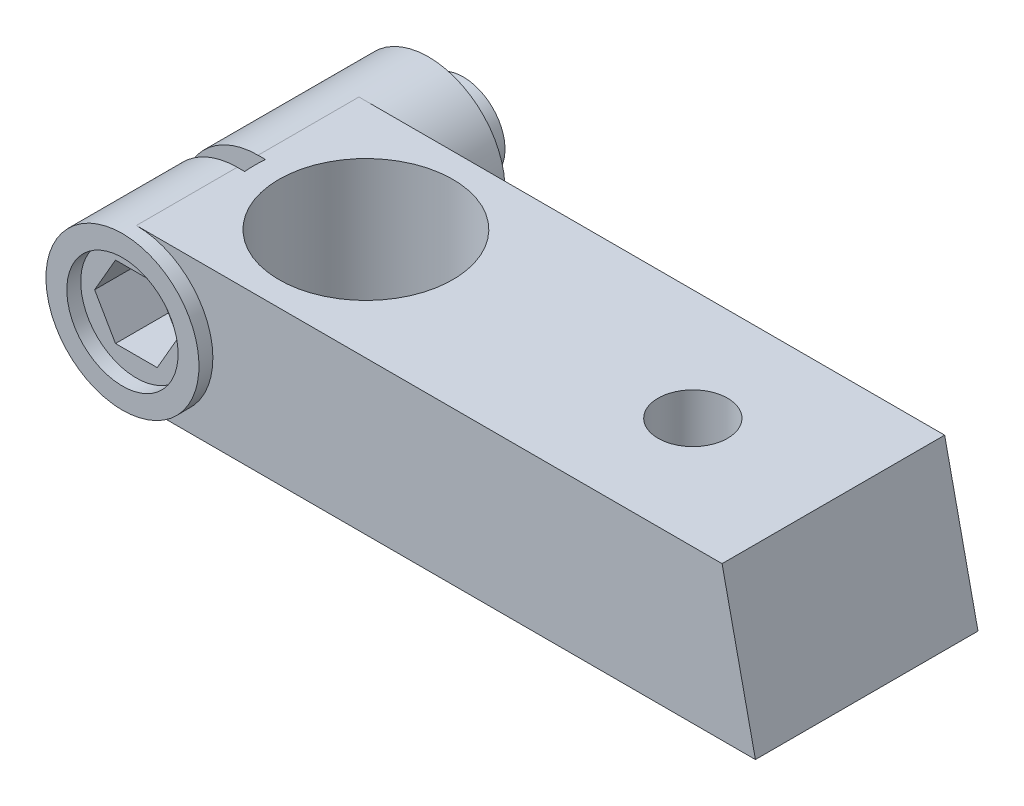
from build123d import *

# Parameters (mm, degrees)
BOSS_EXTRUDE1_DEPTH            = 20
SKETCH2_R                      = 12.5
CUT_EXTRUDE1_DEPTH             = 20
CUT_EXTRUDE3_DEPTH             = 16
BOSS_EXTRUDE9_DEPTH            = 32
CUT_EXTRUDE5_OUTLINE_R         = 12.5
CUT_EXTRUDE5_DEPTH             = 20
SKETCH10_R                     = 7.5
BOSS_EXTRUDE10_DEPTH           = 6
SKETCH11_R                     = 6.5
BOSS_EXTRUDE11_DEPTH           = 5
FILLET5_R                      = 1
FILLET6_R                      = 1
CUT_EXTRUDE7_DEPTH             = 147.965990964
CUT_EXTRUDE7_DEPTH_BACK        = 147.965990964
CUT_EXTRUDE8_REACH             = 148.864
SKETCH21_R                     = 5
CUT_EXTRUDE8_DIRECTION_2_DEPTH = 147.863882558
SKETCH23_R                     = 12.5
SKETCH23_R_2                   = 5
BOSS_EXTRUDE12_DEPTH           = 22
CUT_EXTRUDE13_DEPTH            = 174.703770828
CUT_EXTRUDE13_DEPTH_BACK       = 45
SKETCH24_R                     = 3
SKETCH25_R                     = 11
SKETCH25_R_2                   = 8
BOSS_EXTRUDE13_DEPTH           = 2
BOSS_EXTRUDE14_START           = 10
SKETCH26_R                     = 11
SKETCH26_R_2                   = 3
BOSS_EXTRUDE14_DEPTH           = 10
SKETCH27_R                     = 6
SKETCH27_R_2                   = 3
BOSS_EXTRUDE15_DEPTH           = 5
CUT_EXTRUDE15_DEPTH            = 12


# Read off the part's stored shape, not the designer's step: Cut-Extrude5
with BuildPart() as part:
    # Sketch1 → Boss-Extrude1 (new body)
    with BuildSketch(Plane(origin=(0, 0, 0), x_dir=(1, 0, 0), z_dir=(0, 1, 0))):
        with BuildLine():
            Line((-90, 16), (13.288085522, 16))
            ThreePointArc((13.288085522, 16), (37.171658785, 22.533063908), (53.648380073, 4.05))
            Line((53.648380073, 4.05), (68.648380073, 4.05))
            Line((68.648380073, 4.05), (68.648380073, 0.05))
            Line((68.648380073, 0.05), (53.999946808, 0.05))
            ThreePointArc((53.999946808, 0.05), (54, 0), (53.999946808, -0.05))
            Line((53.999946808, -0.05), (68.648380073, -0.05))
            Line((68.648380073, -0.05), (68.648380073, -4.05))
            Line((68.648380073, -4.05), (53.648380073, -4.05))
            ThreePointArc((53.648380073, -4.05), (37.171658785, -22.533063908), (13.288085522, -16))
            Line((13.288085522, -16), (-90, -16))
            ThreePointArc((-90, -16), (-106, 0), (-90, 16))
        make_face()
    extrude(amount=BOSS_EXTRUDE1_DEPTH)

    # Sketch2 → Cut-Extrude1 (cut)
    with BuildSketch(Plane.XZ):
        with Locations(Location((-90, 0, 0), (0, 0, 270))):
            Circle(SKETCH2_R)
        with BuildLine():
            Line((53.999946808, -0.05), (51.99994186, -0.05))
            ThreePointArc((51.99994186, -0.05), (9, 0), (51.99994186, 0.05))
            Line((51.99994186, 0.05), (53.999946808, 0.05))
            ThreePointArc((53.999946808, 0.05), (54, 0), (53.999946808, -0.05))
        make_face()
    extrude(amount=-CUT_EXTRUDE1_DEPTH, mode=Mode.SUBTRACT)

    # Sketch3 → Cut-Extrude3 (cut)
    with BuildSketch(Plane.XZ):
        with BuildLine():
            Line((-79.416994756, -12), (10.294802649, -12))
            ThreePointArc((10.294802649, -12), (7, 0), (10.294802649, 12))
            Line((10.294802649, 12), (-79.416994756, 12))
            ThreePointArc((-79.416994756, 12), (-75.416994756, 6.583005244), (-74, 0))
            ThreePointArc((-74, 0), (-75.416994756, -6.583005244), (-79.416994756, -12))
        make_face()
    extrude(amount=-CUT_EXTRUDE3_DEPTH, mode=Mode.SUBTRACT)

    # Sketch7 → Boss-Extrude9 (add)
    with BuildSketch(Plane.XY.offset(16)):
        Polygon((-106, 78), (-35.641025641, 78), (-23, 20), (-1, 20), (-18, 98), (-106, 98), align=None)
    extrude(amount=-BOSS_EXTRUDE9_DEPTH)

    # Cut-Extrude5 outline → Cut-Extrude5 (cut)
    with BuildSketch(Plane(origin=(0, 78, 0), x_dir=(1, 0, 0), z_dir=(0, 1, 0))):
        with BuildLine():
            Line((-106, -16), (-90, -16))
            ThreePointArc((-90, -16), (-101.313708581, -11.313708417), (-106, 2.31e-07))
            Line((-106, 2.31e-07), (-106, -16))
        make_face()
        with BuildLine():
            Line((-106, 16), (-106, 2.31e-07))
            ThreePointArc((-106, 2.31e-07), (-101.313708417, 11.313708581), (-90, 16))
            Line((-90, 16), (-106, 16))
        make_face()
        with Locations((-90, 0)):
            Circle(CUT_EXTRUDE5_OUTLINE_R)
    extrude(amount=CUT_EXTRUDE5_DEPTH, mode=Mode.SUBTRACT)

    # Sketch10 → Boss-Extrude10 (add)
    with BuildSketch(Plane(origin=(0, 0, -16), x_dir=(-1, 0, 0), z_dir=(0, 0, -1))):
        with Locations(Location((24, 65, 0), (0, 0, 180))):
            Circle(SKETCH10_R)
    extrude(amount=BOSS_EXTRUDE10_DEPTH)

    # Sketch11 → Boss-Extrude11 (add)
    with BuildSketch(Plane(origin=(0, 0, -22), x_dir=(-1, 0, 0), z_dir=(0, 0, -1))):
        with Locations((24, 65)):
            Circle(SKETCH11_R)
    extrude(amount=BOSS_EXTRUDE11_DEPTH)

    # Fillet5
    fillet5_edges = [part.edges().sort_by_distance(p)[0] for p in [
        (-31.5, 65, -16),
        (-17.5, 65, -27),
        (10.294802649, 8, 12),
        (7, 0, 0),
        (10.294802649, 8, -12),
        (-34.561096053, 0, -12),
        (-79.416994756, 8, -12),
        (-74, 0, 0),
        (-79.416994756, 8, 12),
        (-34.561096053, 0, 12),
        (-34.561096053, 16, 12),
        (7, 16, 0),
        (-74, 16, 0),
    ]]
    fillet(fillet5_edges, radius=FILLET5_R)

    # Fillet6
    fillet6_edges = [part.edges().sort_by_distance(p)[0] for p in [
        (-31.5, 65, -22),
    ]]
    fillet(fillet6_edges, radius=FILLET6_R - 0.0001)  # a hair under: the kernel refuses the full size

    # Sketch20 → Cut-Extrude7 (cut, two sides: drawn at the far end of the back side and taken through both)
    with BuildSketch(Plane(origin=(0, 0, -4.05), x_dir=(-1, 0, 0), z_dir=(0, 0, -1)).offset(-CUT_EXTRUDE7_DEPTH_BACK)):
        with BuildLine():
            Line((-68.648380073, 20), (-68.648380073, 10))
            ThreePointArc((-68.648380073, 10), (-65.719447885, 17.071067812), (-58.648380073, 20))
            Line((-58.648380073, 20), (-68.648380073, 20))
        make_face()
        with BuildLine():
            Line((-68.648380073, 0), (-58.648380073, 0))
            ThreePointArc((-58.648380073, 0), (-65.719447885, 2.928932188), (-68.648380073, 10))
            Line((-68.648380073, 10), (-68.648380073, 0))
        make_face()
        with BuildLine():
            ThreePointArc((-65.648380073, 10), (-59.648380073, 4), (-53.648380073, 10))
            Line((-53.648380073, 10), (-65.648380073, 10))
        make_face()
        with BuildLine():
            Line((-65.648380073, 10), (-53.648380073, 10))
            ThreePointArc((-53.648380073, 10), (-59.648380073, 16), (-65.648380073, 10))
        make_face()
    extrude(amount=CUT_EXTRUDE7_DEPTH + CUT_EXTRUDE7_DEPTH_BACK, mode=Mode.SUBTRACT)

    # Sketch21 → Cut-Extrude8 (cut, up to next)
    with BuildSketch(Plane(origin=(0, 98, 0), x_dir=(1, 0, 0), z_dir=(0, 1, 0)), mode=Mode.PRIVATE) as cut_extrude8_sk1:
        with Locations((-43, 0)):
            Circle(SKETCH21_R)
    cut_extrude8_tool1 = extrude(cut_extrude8_sk1.sketch, amount=-CUT_EXTRUDE8_REACH, mode=Mode.PRIVATE) & part.part
    add(cut_extrude8_tool1.solids().sort_by_distance((-43, 98, 0))[0], mode=Mode.SUBTRACT)

    # Sketch21 → Cut-Extrude8 direction 2 (cut)
    with BuildSketch(Plane(origin=(0, 98, 0), x_dir=(1, 0, 0), z_dir=(0, 1, 0))):
        with Locations((-43, 0)):
            Circle(SKETCH21_R)
    extrude(amount=CUT_EXTRUDE8_DIRECTION_2_DEPTH, mode=Mode.SUBTRACT)



with BuildPart() as body_2:
    # Sketch23 → Boss-Extrude12 (new body)
    with BuildSketch(Plane(origin=(0, 98, 0), x_dir=(1, 0, 0), z_dir=(0, 1, 0))):
        with BuildLine():
            Line((-118, -1.5), (-118, -16))
            Line((-118, -16), (-90, -16))
            Line((-90, -16), (-18, -16))
            Line((-18, -16), (-18, 16))
            Line((-18, 16), (-90, 16))
            Line((-90, 16), (-118, 16))
            Line((-118, 16), (-118, 1.5))
            Line((-118, 1.5), (-105.929532322, 1.5))
            ThreePointArc((-105.929532322, 1.5), (-106, 0), (-105.929532322, -1.5))
            Line((-105.929532322, -1.5), (-118, -1.5))
        make_face()
        with Locations(Location((-90, 0, 0), (0, 0, 90))):
            Circle(SKETCH23_R, mode=Mode.SUBTRACT)
        with Locations((-43, 0)):
            Circle(SKETCH23_R_2, mode=Mode.SUBTRACT)
    extrude(amount=BOSS_EXTRUDE12_DEPTH)

    # Sketch24 → Cut-Extrude13 (cut, two sides: drawn at the far end of the back side and taken through both)
    with BuildSketch(Plane.XY.offset(16).offset(-CUT_EXTRUDE13_DEPTH_BACK)):
        with BuildLine():
            ThreePointArc((-118, 109), (-114.778174593, 116.778174593), (-107, 120))
            Line((-107, 120), (-118, 120))
            Line((-118, 120), (-118, 109))
        make_face()
        with BuildLine():
            Line((-118, 98), (-107, 98))
            ThreePointArc((-107, 98), (-114.778174593, 101.221825407), (-118, 109))
            Line((-118, 109), (-118, 98))
        make_face()
        Polygon((-22.794871795, 120), (-18, 98), (-18, 120), align=None)
        with Locations(Location((-107, 109, 0), (0, 0, 180))):
            Circle(SKETCH24_R)
    extrude(amount=CUT_EXTRUDE13_DEPTH + CUT_EXTRUDE13_DEPTH_BACK, mode=Mode.SUBTRACT)


with BuildPart() as part_1:
    add(part.part)

    add(body_2.part)  # Boss-Extrude13 merges body 2
    # Sketch25 → Boss-Extrude13 (add)
    with BuildSketch(Plane.XY.offset(16)):
        with Locations(Location((-107, 109, 0), (0, 0, 270))):
            Circle(SKETCH25_R)
        with Locations((-107, 109)):
            Circle(SKETCH25_R_2, mode=Mode.SUBTRACT)
    extrude(amount=BOSS_EXTRUDE13_DEPTH)

    # Sketch26 → Boss-Extrude14 (add)
    with BuildSketch(Plane(origin=(0, 0, -16), x_dir=(-1, 0, 0), z_dir=(0, 0, -1)).offset(BOSS_EXTRUDE14_START)):
        with Locations(Location((107, 109, 0), (0, 0, 270))):
            Circle(SKETCH26_R)
        with Locations((107, 109)):
            Circle(SKETCH26_R_2, mode=Mode.SUBTRACT)
    extrude(amount=-BOSS_EXTRUDE14_DEPTH)

    # Sketch27 → Boss-Extrude15 (add)
    with BuildSketch(Plane(origin=(0, 0, -26), x_dir=(-1, 0, 0), z_dir=(0, 0, -1))):
        with Locations((107, 109)):
            Circle(SKETCH27_R)
        with Locations((107, 109)):
            Circle(SKETCH27_R_2, mode=Mode.SUBTRACT)
    extrude(amount=BOSS_EXTRUDE15_DEPTH)

    # Sketch29 → Cut-Extrude15 (cut)
    with BuildSketch(Plane.XY.offset(16)):
        Polygon((-104, 114.196152423), (-110, 114.196152423), (-113, 109), (-110, 103.803847577), (-104, 103.803847577), (-101, 109), align=None)
    extrude(amount=-CUT_EXTRUDE15_DEPTH, mode=Mode.SUBTRACT)

    # SurfaceCut1
    split(bisect_by=Plane(origin=(0, 98, 0), x_dir=(1, 0, 0), z_dir=(0, 1, 0)), keep=Keep.TOP)


solid = part_1.part
